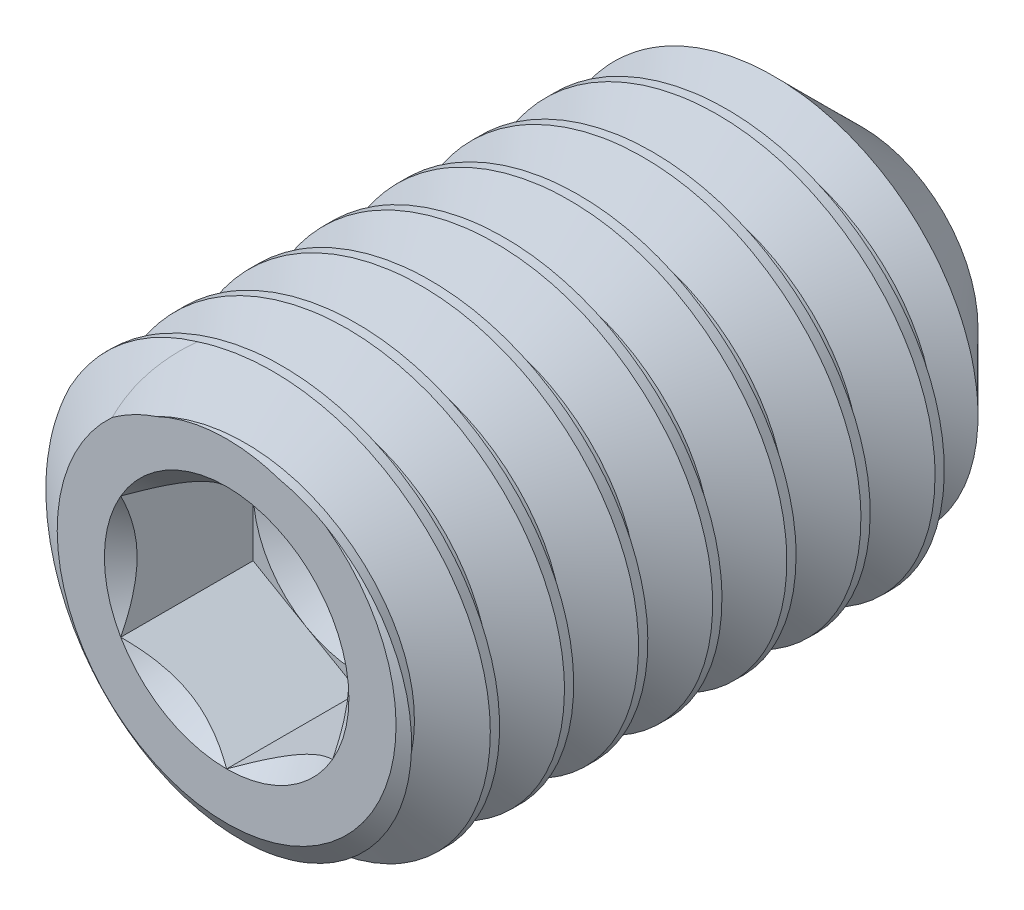
from build123d import *

# Parameters (mm, degrees)
CUT_SWEEP2_PITCH    = 0.7
CUT_EXTRUDE10_DEPTH = 1.25


with BuildPart() as part:
    # Sketch22 → Revolve1 (revolve)
    with BuildSketch(Plane(origin=(0, 0, 0), x_dir=(0, 0, -1), z_dir=(1, 0, 0)), mode=Mode.PRIVATE) as revolve1_sk:
        Polygon((-2.670749467, 0), (-2.670749467, 1.6), (-2.390666452, 2), (2.425180345, 2), (3.329250533, 1.095929813), (2.670749467, 0), align=None)
    revolve(revolve1_sk.sketch.rotate(Axis((0, 0, -2.670749467), (0, 0, -1)), 180), axis=Axis((0, 0, -2.670749467), (0, 0, -1)))

    # Cut-Sweep2: arcs per turn and ends read off the stored shape
    # Cut-Sweep2: the profile of Sketch28 profile screwed along a right-hand helix through 9.571429 turns, 6 arcs to a turn; built about Z, then put on its axis
    cut_sweep2_z = Axis((0, 0, 0), (0, 0, 1))
    cut_sweep2_corners = [(2.0003, 3.49e-07, -0.174826775), (2.0003, 3.49e-07, -0.787673186), (1.545336663, 2.7e-07, -0.524999981), (1.545336663, 2.7e-07, -0.437499981)]
    with BuildLine(mode=Mode.PRIVATE) as cut_sweep2_profile:
        Line(cut_sweep2_corners[0], cut_sweep2_corners[1])
        Line(cut_sweep2_corners[1], cut_sweep2_corners[2])
        Line(cut_sweep2_corners[2], cut_sweep2_corners[3])
        Line(cut_sweep2_corners[3], cut_sweep2_corners[0])
    cut_sweep2_cap = Face(cut_sweep2_profile.wire())
    cut_sweep2_turn_angles = [0, 30, 60, 90, 120, 150, 180, 210, 240, 270, 300, 330, 360]
    cut_sweep2_turn_weights = [1, 0.8660254037844387, 1, 0.8660254037844387, 1, 0.8660254037844387, 1, 0.8660254037844387, 1, 0.8660254037844387, 1, 0.8660254037844387, 1]
    cut_sweep2_turn_rails = [Edge.make_bspline([Vector(p[0], p[1], 0).rotate(cut_sweep2_z, cut_sweep2_turn_angles[k]) / cut_sweep2_turn_weights[k] + Vector(0, 0, p[2] + CUT_SWEEP2_PITCH * cut_sweep2_turn_angles[k] / 360) for k in range(13)], [0, 0, 0, 1, 1, 2, 2, 3, 3, 4, 4, 5, 5, 6, 6, 6], 2, cut_sweep2_turn_weights) for p in cut_sweep2_corners]
    cut_sweep2_turn_sides = [Face.make_surface_from_curves(cut_sweep2_turn_rails[p[0]], cut_sweep2_turn_rails[p[1]]) for p in [(0, 1), (1, 2), (2, 3), (3, 0)]]
    cut_sweep2_last_angles = [3240, 3270, 3300, 3330, 3360, 3390, 3420, 3432.857142857, 3445.714285714]
    cut_sweep2_last_weights = [1, 0.8660254037844387, 1, 0.8660254037844387, 1, 0.8660254037844387, 1, 0.9749279121818535, 1]
    cut_sweep2_last_rails = [Edge.make_bspline([Vector(p[0], p[1], 0).rotate(cut_sweep2_z, cut_sweep2_last_angles[k]) / cut_sweep2_last_weights[k] + Vector(0, 0, p[2] + CUT_SWEEP2_PITCH * cut_sweep2_last_angles[k] / 360) for k in range(9)], [0, 0, 0, 1, 1, 2, 2, 3, 3, 4, 4, 4], 2, cut_sweep2_last_weights) for p in cut_sweep2_corners]
    cut_sweep2_last_sides = [Face.make_surface_from_curves(cut_sweep2_last_rails[p[0]], cut_sweep2_last_rails[p[1]]) for p in [(0, 1), (1, 2), (2, 3), (3, 0)]]
    cut_sweep2 = Plane(origin=(0, 0, -3.329250533), x_dir=(1, 0, 0), z_dir=(0, 0, 1)) * Solid(Shell([*[p.moved(Location((0, 0, CUT_SWEEP2_PITCH * i))) for i in range(9) for p in cut_sweep2_turn_sides], *cut_sweep2_last_sides, cut_sweep2_cap, cut_sweep2_cap.rotate(cut_sweep2_z, 3445.714285714).moved(Location((0, 0, CUT_SWEEP2_PITCH * 3445.714285714 / 360)))]))
    add(cut_sweep2, mode=Mode.SUBTRACT)

    # Sketch23 → Cut-Extrude10 (cut)
    with BuildSketch(Plane.XY.offset(2.670749467)):
        Polygon((0, 1.154700538), (-1, 0.577350269), (-1, -0.577350269), (0, -1.154700538), (1, -0.577350269), (1, 0.577350269), align=None)
    extrude(amount=-CUT_EXTRUDE10_DEPTH, mode=Mode.SUBTRACT)

    # Cut-Extrude11 cone 1 section (through the dimple's axis) → Cut-Extrude11 (revolve, cut)
    with BuildSketch(Plane(origin=(0, 0, 2.670749467), x_dir=(0, -1, 0), z_dir=(1, 0, 0))):
        Polygon((0, 0), (1.154700538, 0), (0, 1.154700538), align=None)
    revolve(axis=Axis((0, 0, 2.670749467), (0, 0, -1)), mode=Mode.SUBTRACT)

    # Cut-Extrude12 cone 1 section (through the dimple's axis) → Cut-Extrude12 (revolve, cut)
    with BuildSketch(Plane(origin=(0, 0, 1.420749467), x_dir=(0, -1, 0), z_dir=(1, 0, 0))):
        Polygon((0, 0), (1, 0), (0, 0.577350269), align=None)
    revolve(axis=Axis((0, 0, 1.420749467), (0, 0, -1)), mode=Mode.SUBTRACT)


solid = part.part
